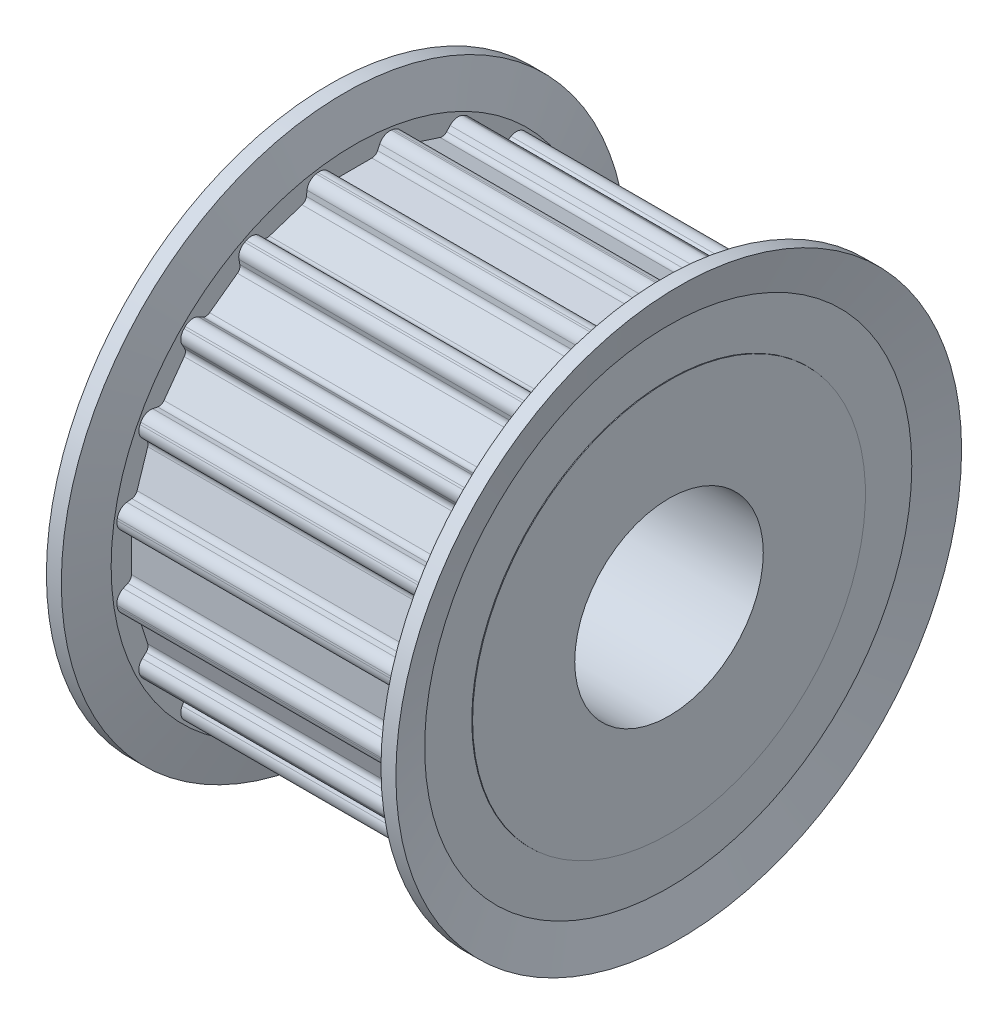
from build123d import *

# Parameters (mm, degrees)
REVOLVE1_START          = 0.05
REVOLVE1_DEPTH          = 20.9
REVOLVE1_START_2        = 20.669872881
REVOLVE1_2_OUTLINE_R    = 18
REVOLVE1_2_DEPTH        = 0.280127119
REVOLVE1_3_OUTLINE_R    = 18
REVOLVE1_3_DEPTH        = 0.280126919
REVOLVE1_4_OUTLINE_R    = 12.5
REVOLVE1_4_DEPTH        = 0.05
FILLET1_R               = 0.4
FILLET2_R               = 0.7
CUT_EXTRUDE2_DEPTH      = 38.561381544
CUT_EXTRUDE2_DEPTH_BACK = 6
SKETCH4_R               = 11.5
SKETCH3_R               = 6
CUT_EXTRUDE1_DEPTH      = 34.397887773


with BuildPart() as part:
    # Revolve1: read off the stored shape, not the designer's step
    # Revolve1 outline → Revolve1 (new body)
    with BuildSketch(Plane.YZ.offset(REVOLVE1_START)):
        with BuildLine():
            ThreePointArc((7.466224335, 13.360333797), (6.948324599, 13.636854853), (6.420200538, 13.893309543))
            Line((6.420200538, 13.893309543), (5.673512702, 13.092584872))
            Line((5.673512702, 13.092584872), (3.105660108, 13.926930756))
            Line((3.105660108, 13.926930756), (2.972231112, 15.013622721))
            ThreePointArc((2.972231112, 15.013622721), (2.394229487, 15.116570053), (1.812704801, 15.197273647))
            Line((1.812704801, 15.197273647), (1.35, 14.205))
            Line((1.35, 14.205), (-1.35, 14.205))
            Line((-1.35, 14.205), (-1.812704801, 15.197273647))
            ThreePointArc((-1.812704801, 15.197273647), (-2.394229487, 15.116570053), (-2.972231112, 15.013622721))
            Line((-2.972231112, 15.013622721), (-3.105660108, 13.926930756))
            Line((-3.105660108, 13.926930756), (-5.673512702, 13.092584872))
            Line((-5.673512702, 13.092584872), (-6.420200538, 13.893309543))
            ThreePointArc((-6.420200538, 13.893309543), (-6.948324599, 13.636854853), (-7.466224335, 13.360333797))
            Line((-7.466224335, 13.360333797), (-7.257316566, 12.285596496))
            Line((-7.257316566, 12.285596496), (-9.441662451, 10.698576315))
            Line((-9.441662451, 10.698576315), (-10.399242314, 11.2293715))
            ThreePointArc((-10.399242314, 11.2293715), (-10.822269286, 10.822269286), (-11.2293715, 10.399242314))
            Line((-11.2293715, 10.399242314), (-10.698576315, 9.441662451))
            Line((-10.698576315, 9.441662451), (-12.285596496, 7.257316566))
            Line((-12.285596496, 7.257316566), (-13.360333797, 7.466224335))
            ThreePointArc((-13.360333797, 7.466224335), (-13.636854853, 6.948324599), (-13.893309543, 6.420200538))
            Line((-13.893309543, 6.420200538), (-13.092584872, 5.673512702))
            Line((-13.092584872, 5.673512702), (-13.926930756, 3.105660108))
            Line((-13.926930756, 3.105660108), (-15.013622721, 2.972231112))
            ThreePointArc((-15.013622721, 2.972231112), (-15.116570053, 2.394229487), (-15.197273647, 1.812704801))
            Line((-15.197273647, 1.812704801), (-14.205, 1.35))
            Line((-14.205, 1.35), (-14.205, -1.35))
            Line((-14.205, -1.35), (-15.197273647, -1.812704801))
            ThreePointArc((-15.197273647, -1.812704801), (-15.116570053, -2.394229487), (-15.013622721, -2.972231112))
            Line((-15.013622721, -2.972231112), (-13.926930756, -3.105660108))
            Line((-13.926930756, -3.105660108), (-13.092584872, -5.673512702))
            Line((-13.092584872, -5.673512702), (-13.893309543, -6.420200538))
            ThreePointArc((-13.893309543, -6.420200538), (-13.636854853, -6.948324599), (-13.360333797, -7.466224335))
            Line((-13.360333797, -7.466224335), (-12.285596496, -7.257316566))
            Line((-12.285596496, -7.257316566), (-10.698576315, -9.441662451))
            Line((-10.698576315, -9.441662451), (-11.2293715, -10.399242314))
            ThreePointArc((-11.2293715, -10.399242314), (-10.822269286, -10.822269286), (-10.399242314, -11.2293715))
            Line((-10.399242314, -11.2293715), (-9.441662451, -10.698576315))
            Line((-9.441662451, -10.698576315), (-7.257316566, -12.285596496))
            Line((-7.257316566, -12.285596496), (-7.466224335, -13.360333797))
            ThreePointArc((-7.466224335, -13.360333797), (-6.948324599, -13.636854853), (-6.420200538, -13.893309543))
            Line((-6.420200538, -13.893309543), (-5.673512702, -13.092584872))
            Line((-5.673512702, -13.092584872), (-3.105660108, -13.926930756))
            Line((-3.105660108, -13.926930756), (-2.972231112, -15.013622721))
            ThreePointArc((-2.972231112, -15.013622721), (-2.394229487, -15.116570053), (-1.812704801, -15.197273647))
            Line((-1.812704801, -15.197273647), (-1.35, -14.205))
            Line((-1.35, -14.205), (1.35, -14.205))
            Line((1.35, -14.205), (1.812704801, -15.197273647))
            ThreePointArc((1.812704801, -15.197273647), (2.394229487, -15.116570053), (2.972231112, -15.013622721))
            Line((2.972231112, -15.013622721), (3.105660108, -13.926930756))
            Line((3.105660108, -13.926930756), (5.673512702, -13.092584872))
            Line((5.673512702, -13.092584872), (6.420200538, -13.893309543))
            ThreePointArc((6.420200538, -13.893309543), (6.948324599, -13.636854853), (7.466224335, -13.360333797))
            Line((7.466224335, -13.360333797), (7.257316566, -12.285596496))
            Line((7.257316566, -12.285596496), (9.441662451, -10.698576315))
            Line((9.441662451, -10.698576315), (10.399242314, -11.2293715))
            ThreePointArc((10.399242314, -11.2293715), (10.822269286, -10.822269286), (11.2293715, -10.399242314))
            Line((11.2293715, -10.399242314), (10.698576315, -9.441662451))
            Line((10.698576315, -9.441662451), (12.285596496, -7.257316566))
            Line((12.285596496, -7.257316566), (13.360333797, -7.466224335))
            ThreePointArc((13.360333797, -7.466224335), (13.636854853, -6.948324599), (13.893309543, -6.420200538))
            Line((13.893309543, -6.420200538), (13.092584872, -5.673512702))
            Line((13.092584872, -5.673512702), (13.926930756, -3.105660108))
            Line((13.926930756, -3.105660108), (15.013622721, -2.972231112))
            ThreePointArc((15.013622721, -2.972231112), (15.116570053, -2.394229487), (15.197273647, -1.812704801))
            Line((15.197273647, -1.812704801), (14.205, -1.35))
            Line((14.205, -1.35), (14.205, 1.35))
            Line((14.205, 1.35), (15.197273647, 1.812704801))
            ThreePointArc((15.197273647, 1.812704801), (15.116570053, 2.394229487), (15.013622721, 2.972231112))
            Line((15.013622721, 2.972231112), (13.926930756, 3.105660108))
            Line((13.926930756, 3.105660108), (13.092584872, 5.673512702))
            Line((13.092584872, 5.673512702), (13.893309543, 6.420200538))
            ThreePointArc((13.893309543, 6.420200538), (13.636854853, 6.948324599), (13.360333797, 7.466224335))
            Line((13.360333797, 7.466224335), (12.285596496, 7.257316566))
            Line((12.285596496, 7.257316566), (10.698576315, 9.441662451))
            Line((10.698576315, 9.441662451), (11.2293715, 10.399242314))
            ThreePointArc((11.2293715, 10.399242314), (10.822269286, 10.822269286), (10.399242314, 11.2293715))
            Line((10.399242314, 11.2293715), (9.441662451, 10.698576315))
            Line((9.441662451, 10.698576315), (7.257316566, 12.285596496))
            Line((7.257316566, 12.285596496), (7.466224335, 13.360333797))
        make_face()
    extrude(amount=REVOLVE1_DEPTH)

    # Revolve1 2 outline → Revolve1 2 (add)
    with BuildSketch(Plane.YZ.offset(REVOLVE1_START_2)):
        Circle(REVOLVE1_2_OUTLINE_R)
        with BuildLine():
            Line((5.673512702, 13.092584872), (6.420200538, 13.893309543))
            ThreePointArc((6.420200538, 13.893309543), (6.948324599, 13.636854853), (7.466224335, 13.360333797))
            Line((7.466224335, 13.360333797), (7.257316566, 12.285596496))
            Line((7.257316566, 12.285596496), (9.441662451, 10.698576315))
            Line((9.441662451, 10.698576315), (10.399242314, 11.2293715))
            ThreePointArc((10.399242314, 11.2293715), (10.822269286, 10.822269286), (11.2293715, 10.399242314))
            Line((11.2293715, 10.399242314), (10.698576315, 9.441662451))
            Line((10.698576315, 9.441662451), (12.285596496, 7.257316566))
            Line((12.285596496, 7.257316566), (13.360333797, 7.466224335))
            ThreePointArc((13.360333797, 7.466224335), (13.636854853, 6.948324599), (13.893309543, 6.420200538))
            Line((13.893309543, 6.420200538), (13.092584872, 5.673512702))
            Line((13.092584872, 5.673512702), (13.926930756, 3.105660108))
            Line((13.926930756, 3.105660108), (15.013622721, 2.972231112))
            ThreePointArc((15.013622721, 2.972231112), (15.116570053, 2.394229487), (15.197273647, 1.812704801))
            Line((15.197273647, 1.812704801), (14.205, 1.35))
            Line((14.205, 1.35), (14.205, -1.35))
            Line((14.205, -1.35), (15.197273647, -1.812704801))
            ThreePointArc((15.197273647, -1.812704801), (15.116570053, -2.394229487), (15.013622721, -2.972231112))
            Line((15.013622721, -2.972231112), (13.926930756, -3.105660108))
            Line((13.926930756, -3.105660108), (13.092584872, -5.673512702))
            Line((13.092584872, -5.673512702), (13.893309543, -6.420200538))
            ThreePointArc((13.893309543, -6.420200538), (13.636854853, -6.948324599), (13.360333797, -7.466224335))
            Line((13.360333797, -7.466224335), (12.285596496, -7.257316566))
            Line((12.285596496, -7.257316566), (10.698576315, -9.441662451))
            Line((10.698576315, -9.441662451), (11.2293715, -10.399242314))
            ThreePointArc((11.2293715, -10.399242314), (10.822269286, -10.822269286), (10.399242314, -11.2293715))
            Line((10.399242314, -11.2293715), (9.441662451, -10.698576315))
            Line((9.441662451, -10.698576315), (7.257316566, -12.285596496))
            Line((7.257316566, -12.285596496), (7.466224335, -13.360333797))
            ThreePointArc((7.466224335, -13.360333797), (6.948324599, -13.636854853), (6.420200538, -13.893309543))
            Line((6.420200538, -13.893309543), (5.673512702, -13.092584872))
            Line((5.673512702, -13.092584872), (3.105660108, -13.926930756))
            Line((3.105660108, -13.926930756), (2.972231112, -15.013622721))
            ThreePointArc((2.972231112, -15.013622721), (2.394229487, -15.116570053), (1.812704801, -15.197273647))
            Line((1.812704801, -15.197273647), (1.35, -14.205))
            Line((1.35, -14.205), (-1.35, -14.205))
            Line((-1.35, -14.205), (-1.812704801, -15.197273647))
            ThreePointArc((-1.812704801, -15.197273647), (-2.394229487, -15.116570053), (-2.972231112, -15.013622721))
            Line((-2.972231112, -15.013622721), (-3.105660108, -13.926930756))
            Line((-3.105660108, -13.926930756), (-5.673512702, -13.092584872))
            Line((-5.673512702, -13.092584872), (-6.420200538, -13.893309543))
            ThreePointArc((-6.420200538, -13.893309543), (-6.948324599, -13.636854853), (-7.466224335, -13.360333797))
            Line((-7.466224335, -13.360333797), (-7.257316566, -12.285596496))
            Line((-7.257316566, -12.285596496), (-9.441662451, -10.698576315))
            Line((-9.441662451, -10.698576315), (-10.399242314, -11.2293715))
            ThreePointArc((-10.399242314, -11.2293715), (-10.822269286, -10.822269286), (-11.2293715, -10.399242314))
            Line((-11.2293715, -10.399242314), (-10.698576315, -9.441662451))
            Line((-10.698576315, -9.441662451), (-12.285596496, -7.257316566))
            Line((-12.285596496, -7.257316566), (-13.360333797, -7.466224335))
            ThreePointArc((-13.360333797, -7.466224335), (-13.636854853, -6.948324599), (-13.893309543, -6.420200538))
            Line((-13.893309543, -6.420200538), (-13.092584872, -5.673512702))
            Line((-13.092584872, -5.673512702), (-13.926930756, -3.105660108))
            Line((-13.926930756, -3.105660108), (-15.013622721, -2.972231112))
            ThreePointArc((-15.013622721, -2.972231112), (-15.116570053, -2.394229487), (-15.197273647, -1.812704801))
            Line((-15.197273647, -1.812704801), (-14.205, -1.35))
            Line((-14.205, -1.35), (-14.205, 1.35))
            Line((-14.205, 1.35), (-15.197273647, 1.812704801))
            ThreePointArc((-15.197273647, 1.812704801), (-15.116570053, 2.394229487), (-15.013622721, 2.972231112))
            Line((-15.013622721, 2.972231112), (-13.926930756, 3.105660108))
            Line((-13.926930756, 3.105660108), (-13.092584872, 5.673512702))
            Line((-13.092584872, 5.673512702), (-13.893309543, 6.420200538))
            ThreePointArc((-13.893309543, 6.420200538), (-13.636854853, 6.948324599), (-13.360333797, 7.466224335))
            Line((-13.360333797, 7.466224335), (-12.285596496, 7.257316566))
            Line((-12.285596496, 7.257316566), (-10.698576315, 9.441662451))
            Line((-10.698576315, 9.441662451), (-11.2293715, 10.399242314))
            ThreePointArc((-11.2293715, 10.399242314), (-10.822269286, 10.822269286), (-10.399242314, 11.2293715))
            Line((-10.399242314, 11.2293715), (-9.441662451, 10.698576315))
            Line((-9.441662451, 10.698576315), (-7.257316566, 12.285596496))
            Line((-7.257316566, 12.285596496), (-7.466224335, 13.360333797))
            ThreePointArc((-7.466224335, 13.360333797), (-6.948324599, 13.636854853), (-6.420200538, 13.893309543))
            Line((-6.420200538, 13.893309543), (-5.673512702, 13.092584872))
            Line((-5.673512702, 13.092584872), (-3.105660108, 13.926930756))
            Line((-3.105660108, 13.926930756), (-2.972231112, 15.013622721))
            ThreePointArc((-2.972231112, 15.013622721), (-2.394229487, 15.116570053), (-1.812704801, 15.197273647))
            Line((-1.812704801, 15.197273647), (-1.35, 14.205))
            Line((-1.35, 14.205), (1.35, 14.205))
            Line((1.35, 14.205), (1.812704801, 15.197273647))
            ThreePointArc((1.812704801, 15.197273647), (2.394229487, 15.116570053), (2.972231112, 15.013622721))
            Line((2.972231112, 15.013622721), (3.105660108, 13.926930756))
            Line((3.105660108, 13.926930756), (5.673512702, 13.092584872))
        make_face(mode=Mode.SUBTRACT)
    extrude(amount=REVOLVE1_2_DEPTH)

    # Revolve1 3 outline → Revolve1 3 (add)
    with BuildSketch(Plane.YZ.offset(REVOLVE1_START)):
        Circle(REVOLVE1_3_OUTLINE_R)
        with BuildLine():
            Line((5.673512702, 13.092584872), (6.420200538, 13.893309543))
            ThreePointArc((6.420200538, 13.893309543), (6.948324599, 13.636854853), (7.466224335, 13.360333797))
            Line((7.466224335, 13.360333797), (7.257316566, 12.285596496))
            Line((7.257316566, 12.285596496), (9.441662451, 10.698576315))
            Line((9.441662451, 10.698576315), (10.399242314, 11.2293715))
            ThreePointArc((10.399242314, 11.2293715), (10.822269286, 10.822269286), (11.2293715, 10.399242314))
            Line((11.2293715, 10.399242314), (10.698576315, 9.441662451))
            Line((10.698576315, 9.441662451), (12.285596496, 7.257316566))
            Line((12.285596496, 7.257316566), (13.360333797, 7.466224335))
            ThreePointArc((13.360333797, 7.466224335), (13.636854853, 6.948324599), (13.893309543, 6.420200538))
            Line((13.893309543, 6.420200538), (13.092584872, 5.673512702))
            Line((13.092584872, 5.673512702), (13.926930756, 3.105660108))
            Line((13.926930756, 3.105660108), (15.013622721, 2.972231112))
            ThreePointArc((15.013622721, 2.972231112), (15.116570053, 2.394229487), (15.197273647, 1.812704801))
            Line((15.197273647, 1.812704801), (14.205, 1.35))
            Line((14.205, 1.35), (14.205, -1.35))
            Line((14.205, -1.35), (15.197273647, -1.812704801))
            ThreePointArc((15.197273647, -1.812704801), (15.116570053, -2.394229487), (15.013622721, -2.972231112))
            Line((15.013622721, -2.972231112), (13.926930756, -3.105660108))
            Line((13.926930756, -3.105660108), (13.092584872, -5.673512702))
            Line((13.092584872, -5.673512702), (13.893309543, -6.420200538))
            ThreePointArc((13.893309543, -6.420200538), (13.636854853, -6.948324599), (13.360333797, -7.466224335))
            Line((13.360333797, -7.466224335), (12.285596496, -7.257316566))
            Line((12.285596496, -7.257316566), (10.698576315, -9.441662451))
            Line((10.698576315, -9.441662451), (11.2293715, -10.399242314))
            ThreePointArc((11.2293715, -10.399242314), (10.822269286, -10.822269286), (10.399242314, -11.2293715))
            Line((10.399242314, -11.2293715), (9.441662451, -10.698576315))
            Line((9.441662451, -10.698576315), (7.257316566, -12.285596496))
            Line((7.257316566, -12.285596496), (7.466224335, -13.360333797))
            ThreePointArc((7.466224335, -13.360333797), (6.948324599, -13.636854853), (6.420200538, -13.893309543))
            Line((6.420200538, -13.893309543), (5.673512702, -13.092584872))
            Line((5.673512702, -13.092584872), (3.105660108, -13.926930756))
            Line((3.105660108, -13.926930756), (2.972231112, -15.013622721))
            ThreePointArc((2.972231112, -15.013622721), (2.394229487, -15.116570053), (1.812704801, -15.197273647))
            Line((1.812704801, -15.197273647), (1.35, -14.205))
            Line((1.35, -14.205), (-1.35, -14.205))
            Line((-1.35, -14.205), (-1.812704801, -15.197273647))
            ThreePointArc((-1.812704801, -15.197273647), (-2.394229487, -15.116570053), (-2.972231112, -15.013622721))
            Line((-2.972231112, -15.013622721), (-3.105660108, -13.926930756))
            Line((-3.105660108, -13.926930756), (-5.673512702, -13.092584872))
            Line((-5.673512702, -13.092584872), (-6.420200538, -13.893309543))
            ThreePointArc((-6.420200538, -13.893309543), (-6.948324599, -13.636854853), (-7.466224335, -13.360333797))
            Line((-7.466224335, -13.360333797), (-7.257316566, -12.285596496))
            Line((-7.257316566, -12.285596496), (-9.441662451, -10.698576315))
            Line((-9.441662451, -10.698576315), (-10.399242314, -11.2293715))
            ThreePointArc((-10.399242314, -11.2293715), (-10.822269286, -10.822269286), (-11.2293715, -10.399242314))
            Line((-11.2293715, -10.399242314), (-10.698576315, -9.441662451))
            Line((-10.698576315, -9.441662451), (-12.285596496, -7.257316566))
            Line((-12.285596496, -7.257316566), (-13.360333797, -7.466224335))
            ThreePointArc((-13.360333797, -7.466224335), (-13.636854853, -6.948324599), (-13.893309543, -6.420200538))
            Line((-13.893309543, -6.420200538), (-13.092584872, -5.673512702))
            Line((-13.092584872, -5.673512702), (-13.926930756, -3.105660108))
            Line((-13.926930756, -3.105660108), (-15.013622721, -2.972231112))
            ThreePointArc((-15.013622721, -2.972231112), (-15.116570053, -2.394229487), (-15.197273647, -1.812704801))
            Line((-15.197273647, -1.812704801), (-14.205, -1.35))
            Line((-14.205, -1.35), (-14.205, 1.35))
            Line((-14.205, 1.35), (-15.197273647, 1.812704801))
            ThreePointArc((-15.197273647, 1.812704801), (-15.116570053, 2.394229487), (-15.013622721, 2.972231112))
            Line((-15.013622721, 2.972231112), (-13.926930756, 3.105660108))
            Line((-13.926930756, 3.105660108), (-13.092584872, 5.673512702))
            Line((-13.092584872, 5.673512702), (-13.893309543, 6.420200538))
            ThreePointArc((-13.893309543, 6.420200538), (-13.636854853, 6.948324599), (-13.360333797, 7.466224335))
            Line((-13.360333797, 7.466224335), (-12.285596496, 7.257316566))
            Line((-12.285596496, 7.257316566), (-10.698576315, 9.441662451))
            Line((-10.698576315, 9.441662451), (-11.2293715, 10.399242314))
            ThreePointArc((-11.2293715, 10.399242314), (-10.822269286, 10.822269286), (-10.399242314, 11.2293715))
            Line((-10.399242314, 11.2293715), (-9.441662451, 10.698576315))
            Line((-9.441662451, 10.698576315), (-7.257316566, 12.285596496))
            Line((-7.257316566, 12.285596496), (-7.466224335, 13.360333797))
            ThreePointArc((-7.466224335, 13.360333797), (-6.948324599, 13.636854853), (-6.420200538, 13.893309543))
            Line((-6.420200538, 13.893309543), (-5.673512702, 13.092584872))
            Line((-5.673512702, 13.092584872), (-3.105660108, 13.926930756))
            Line((-3.105660108, 13.926930756), (-2.972231112, 15.013622721))
            ThreePointArc((-2.972231112, 15.013622721), (-2.394229487, 15.116570053), (-1.812704801, 15.197273647))
            Line((-1.812704801, 15.197273647), (-1.35, 14.205))
            Line((-1.35, 14.205), (1.35, 14.205))
            Line((1.35, 14.205), (1.812704801, 15.197273647))
            ThreePointArc((1.812704801, 15.197273647), (2.394229487, 15.116570053), (2.972231112, 15.013622721))
            Line((2.972231112, 15.013622721), (3.105660108, 13.926930756))
            Line((3.105660108, 13.926930756), (5.673512702, 13.092584872))
        make_face(mode=Mode.SUBTRACT)
    extrude(amount=REVOLVE1_3_DEPTH)

    # Revolve1 4 outline → Revolve1 4 (add)
    with BuildSketch(Plane.YZ):
        Circle(REVOLVE1_4_OUTLINE_R)
    extrude(amount=REVOLVE1_4_DEPTH)

    # Revolve1 5 outline → Revolve1 5 (revolve)
    with BuildSketch(Plane.YX):
        Polygon((18, 21.619872981), (15.5, 20.95), (18, 20.95), align=None)
        Polygon((14.205, 20), (15.5, 20), (18, 20.669872981), (14.205, 20.669872881), align=None)
        Polygon((14.205, 0.330126919), (18, 0.330126979), (15.5, 1), (14.205, 1), align=None)
        Polygon((18, -0.619872981), (18, 0.05), (15.5, 0.05), align=None)
    revolve(axis=Axis((0, 0, 0), (1, 0, 0)))

    # Sketch2 → Revolve2 (revolve)
    with BuildSketch(Plane(origin=(0, 0, 0), x_dir=(-1, 0, 0), z_dir=(0, 0, -1)), mode=Mode.PRIVATE) as revolve2_sk:
        Polygon((-27, 11.5), (-27, 0), (-20.95, 0), (-20.95, 12.5), (-21, 12.5), (-21, 11.5), align=None)
    revolve(revolve2_sk.sketch.rotate(Axis((27, 0, 0), (-1, 0, 0)), 270), axis=Axis((27, 0, 0), (-1, 0, 0)))

    # Fillet1
    fillet1_edges = [part.edges().sort_by_distance(p)[0] for p in [
        (10.5, -13.092584872, 5.673512702),
        (10.5, -9.441662451, -10.698576315),
        (10.5, 1.35, 14.205),
        (10.5, 5.673512702, 13.092584872),
        (10.5, -13.926930756, -3.105660108),
        (10.5, 7.257316566, 12.285596496),
        (10.5, -7.257316566, 12.285596496),
        (10.5, 9.441662451, 10.698576315),
        (10.5, -5.673512702, -13.092584872),
        (10.5, 10.698576315, 9.441662451),
        (10.5, -12.285596496, -7.257316566),
        (10.5, 12.285596496, 7.257316566),
        (10.5, -14.205, 1.35),
        (10.5, 13.092584872, 5.673512702),
        (10.5, -10.698576315, 9.441662451),
        (10.5, 13.926930756, 3.105660108),
        (10.5, -3.105660108, 13.926930756),
        (10.5, 14.205, 1.35),
        (10.5, -3.105660108, -13.926930756),
        (10.5, 14.205, -1.35),
        (10.5, -7.257316566, -12.285596496),
        (10.5, 13.926930756, -3.105660108),
        (10.5, -10.698576315, -9.441662451),
        (10.5, 13.092584872, -5.673512702),
        (10.5, -13.092584872, -5.673512702),
        (10.5, 12.285596496, -7.257316566),
        (10.5, -14.205, -1.35),
        (10.5, 10.698576315, -9.441662451),
        (10.5, -13.926930756, 3.105660108),
        (10.5, 9.441662451, -10.698576315),
        (10.5, -12.285596496, 7.257316566),
        (10.5, 7.257316566, -12.285596496),
        (10.5, -9.441662451, 10.698576315),
        (10.5, 5.673512702, -13.092584872),
        (10.5, -5.673512702, 13.092584872),
        (10.5, 3.105660108, -13.926930756),
        (10.5, -1.35, 14.205),
        (10.5, 1.35, -14.205),
        (10.5, 3.105660108, 13.926930756),
        (10.5, -1.35, -14.205),
    ]]
    fillet(fillet1_edges, radius=FILLET1_R)

    # Fillet2
    fillet2_edges = [part.edges().sort_by_distance(p)[0] for p in [
        (10.5, -13.893309543, 6.420200538),
        (10.5, -10.399242314, -11.2293715),
        (10.5, 2.972231112, 15.013622721),
        (10.5, 6.420200538, 13.893309543),
        (10.5, -15.013622721, -2.972231112),
        (10.5, 7.466224335, 13.360333797),
        (10.5, -7.466224335, 13.360333797),
        (10.5, 10.399242314, 11.2293715),
        (10.5, -6.420200538, -13.893309543),
        (10.5, 11.2293715, 10.399242314),
        (10.5, -13.360333797, -7.466224335),
        (10.5, 13.360333797, 7.466224335),
        (10.5, -15.197273647, 1.812704801),
        (10.5, 13.893309543, 6.420200538),
        (10.5, -11.2293715, 10.399242314),
        (10.5, 15.013622721, 2.972231112),
        (10.5, -2.972231112, 15.013622721),
        (10.5, 15.197273647, 1.812704801),
        (10.5, -2.972231112, -15.013622721),
        (10.5, 15.197273647, -1.812704801),
        (10.5, -7.466224335, -13.360333797),
        (10.5, 15.013622721, -2.972231112),
        (10.5, -11.2293715, -10.399242314),
        (10.5, 13.893309543, -6.420200538),
        (10.5, -13.893309543, -6.420200538),
        (10.5, 13.360333797, -7.466224335),
        (10.5, -15.197273647, -1.812704801),
        (10.5, 11.2293715, -10.399242314),
        (10.5, -15.013622721, 2.972231112),
        (10.5, 10.399242314, -11.2293715),
        (10.5, -13.360333797, 7.466224335),
        (10.5, 7.466224335, -13.360333797),
        (10.5, -10.399242314, 11.2293715),
        (10.5, 6.420200538, -13.893309543),
        (10.5, -6.420200538, 13.893309543),
        (10.5, 2.972231112, -15.013622721),
        (10.5, -1.812704801, 15.197273647),
        (10.5, 1.812704801, -15.197273647),
        (10.5, -1.812704801, -15.197273647),
        (10.5, 1.812704801, 15.197273647),
    ]]
    fillet(fillet2_edges, radius=FILLET2_R)

    # Sketch4 → Cut-Extrude2 (cut, two sides: drawn at the far end of the back side and taken through both)
    with BuildSketch(Plane(origin=(27, 0, 0), x_dir=(0, 0, -1), z_dir=(1, 0, 0)).offset(-CUT_EXTRUDE2_DEPTH_BACK)):
        Circle(SKETCH4_R)
    extrude(amount=CUT_EXTRUDE2_DEPTH + CUT_EXTRUDE2_DEPTH_BACK, mode=Mode.SUBTRACT)

    # Sketch3 → Cut-Extrude1 (cut, through all)
    with BuildSketch(Plane(origin=(21, 0, 0), x_dir=(0, 0, -1), z_dir=(1, 0, 0))):
        Circle(SKETCH3_R)
    extrude(amount=-CUT_EXTRUDE1_DEPTH, mode=Mode.SUBTRACT)


solid = part.part
